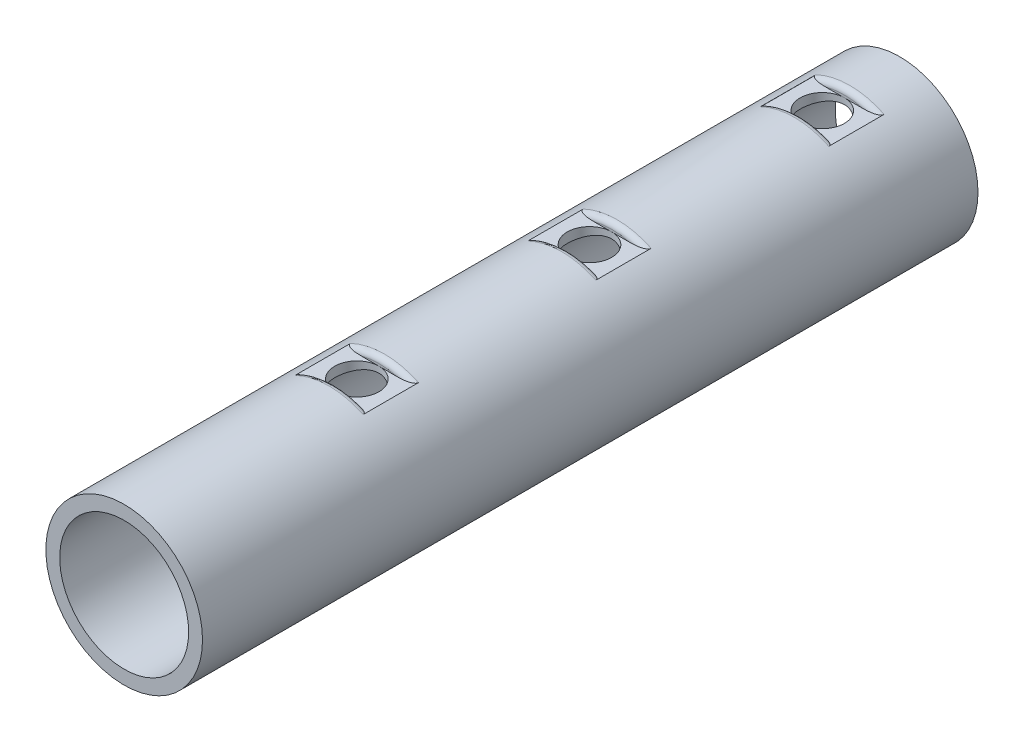
from build123d import *

# Parameters (mm, degrees)
SKETCH1_R              = 14.14
SKETCH1_R_2            = 11.64
BOSS_EXTRUDE1_DEPTH    = 140
SKETCH2_W              = 12.332677781
SKETCH2_H              = 2.901386509
CUT_EXTRUDE1_DEPTH     = 8
SKETCH3_R              = 4
CUT_EXTRUDE2_DEPTH     = 10
FILLET1_R              = 1
SKETCH4_W              = 12.27253506
SKETCH4_H              = 2.991853872
CUT_EXTRUDE3_DEPTH     = 4
SKETCH5_R              = 4
CUT_EXTRUDE4_DEPTH     = 4
FILLET2_R              = 1
LPATTERN1_COUNT        = 2
LPATTERN1_PITCH        = 42
FILLET2_OF_LPATTERN1_R = 1


with BuildPart() as part:
    # Sketch1 → Boss-Extrude1 (new body)
    with BuildSketch(Plane.XY):
        Circle(SKETCH1_R)
        Circle(SKETCH1_R_2, mode=Mode.SUBTRACT)
    extrude(amount=BOSS_EXTRUDE1_DEPTH)

    # Sketch2 → Cut-Extrude1 (cut)
    with BuildSketch(Plane(origin=(0, 0, 10), x_dir=(-1, 0, 0), z_dir=(0, 0, -1))):
        with Locations((-0.030071361, 14.160693254)):
            Rectangle(SKETCH2_W, SKETCH2_H)
    extrude(amount=-CUT_EXTRUDE1_DEPTH, mode=Mode.SUBTRACT)

    # Sketch3 → Cut-Extrude2 (cut)
    with BuildSketch(Plane(origin=(0, 12.71, 0), x_dir=(1, 0, 0), z_dir=(0, 1, 0))):
        with Locations(Location((0.030071361, -14, 0), (0, 0, 270))):
            Circle(SKETCH3_R)
    extrude(amount=-CUT_EXTRUDE2_DEPTH, mode=Mode.SUBTRACT)

    # Fillet1
    # the kernel refuses this fillet: 1 mm, written as the material it takes off along each edge
    with BuildSketch(Plane(origin=(0, 0, 10), x_dir=(-0.585677911723241, 0.8105438814274669, 0), z_dir=(-0.8105438814274669, -0.585677911723241, 0))) as fillet1_piece_1_section:
        with BuildLine():
            CenterArc((14.14 - FILLET1_R, FILLET1_R), FILLET1_R, 270, 90)
            Line((14.14 - FILLET1_R, 0), (14.14, 0))
            Line((14.14, 0), (14.14, FILLET1_R))
        make_face()
    fillet1_piece_1 = revolve(axis=Axis((0, 0, 10), (0, 0, -1)), revolution_arc=71.972599758, mode=Mode.PRIVATE)
    fillet1_piece_1 = split(fillet1_piece_1, bisect_by=Plane(origin=(0.026539027, 12.71, 9.717258604), z_dir=(0, 1, 0)), keep=Keep.TOP, mode=Mode.PRIVATE)
    fillet1_piece_1 = split(fillet1_piece_1, bisect_by=Plane(origin=(-6.13626753, 13.857233191, 9.717258604), z_dir=(1, 0, 0)), keep=Keep.TOP, mode=Mode.PRIVATE)
    add(fillet1_piece_1, mode=Mode.SUBTRACT)
    with BuildSketch(Plane(origin=(0, 0, 18), x_dir=(-0.585677911723241, 0.8105438814274669, 0), z_dir=(-0.8105438814274669, -0.585677911723241, 0))) as fillet1_piece_2_section:
        with BuildLine():
            CenterArc((14.14 - FILLET1_R, -FILLET1_R), FILLET1_R, 0, 90)
            Line((14.14 - FILLET1_R, 0), (14.14, 0))
            Line((14.14, 0), (14.14, -FILLET1_R))
        make_face()
    fillet1_piece_2 = revolve(axis=Axis((0, 0, 18), (0, 0, -1)), revolution_arc=71.972599758, mode=Mode.PRIVATE)
    fillet1_piece_2 = split(fillet1_piece_2, bisect_by=Plane(origin=(0.026539027, 12.71, 18.282741396), z_dir=(0, 1, 0)), keep=Keep.TOP, mode=Mode.PRIVATE)
    fillet1_piece_2 = split(fillet1_piece_2, bisect_by=Plane(origin=(-6.13626753, 13.857233191, 18.282741396), z_dir=(1, 0, 0)), keep=Keep.TOP, mode=Mode.PRIVATE)
    add(fillet1_piece_2, mode=Mode.SUBTRACT)

    # Sketch4 → Cut-Extrude3 (cut, symmetric)
    with BuildSketch(Plane(origin=(0, 0, 56), x_dir=(-1, 0, 0), z_dir=(0, 0, -1))):
        with Locations((0, 14.235072151)):
            Rectangle(SKETCH4_W, SKETCH4_H)
    cut_extrude3 = extrude(amount=CUT_EXTRUDE3_DEPTH, both=True, mode=Mode.SUBTRACT)

    # Sketch5 → Cut-Extrude4 (cut, symmetric)
    with BuildSketch(Plane(origin=(0, 12.739145215, 0), x_dir=(1, 0, 0), z_dir=(0, 1, 0))):
        with Locations(Location((0, -56, 0), (0, 0, 270))):
            Circle(SKETCH5_R)
    cut_extrude4 = extrude(amount=CUT_EXTRUDE4_DEPTH, both=True, mode=Mode.SUBTRACT)

    # Fillet2
    fillet2_edges = [part.edges().sort_by_distance(p)[0] for p in [
        (0, 14.14, 52),
        (0, 14.14, 60),
    ]]
    fillet(fillet2_edges, radius=FILLET2_R)

    # LPattern1: Cut-Extrude3, Cut-Extrude4 ×2
    with Locations(*[(0, 0, i * LPATTERN1_PITCH) for i in range(1, LPATTERN1_COUNT)]):
        add(cut_extrude3, mode=Mode.SUBTRACT)
        add(cut_extrude4, mode=Mode.SUBTRACT)

    # Fillet2 of LPattern1
    fillet2_of_lpattern1_edges = [part.edges().sort_by_distance(p)[0] for p in [
        (0, 14.14, 94),
        (0, 14.14, 102),
    ]]
    fillet(fillet2_of_lpattern1_edges, radius=FILLET2_OF_LPATTERN1_R)


solid = part.part
